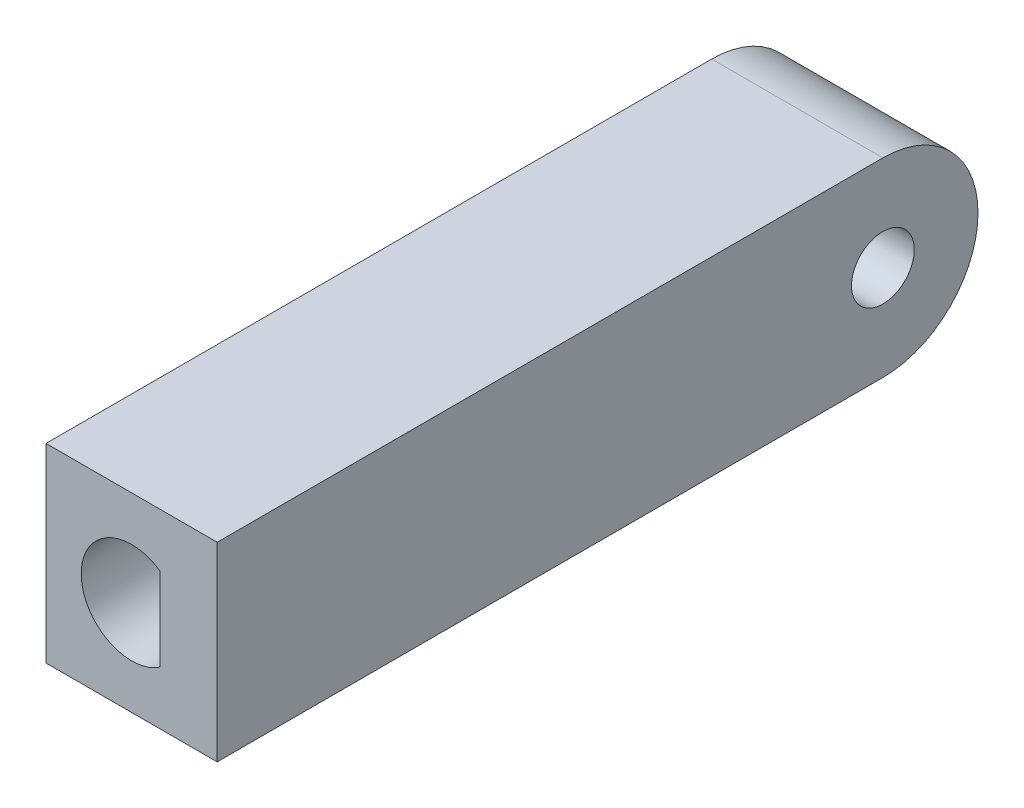
from build123d import *

# Parameters (mm, degrees)
SKIZZE1_W                       = 9
SKIZZE1_H                       = 10
AUFSATZ_LINEAR_AUSTRAGEN1_DEPTH = 40
SKIZZE3_R                       = 1.65
SCHNITT_LINEAR_AUSTRAGEN2_DEPTH = 43.201895692
VERRUNDUNG1_R                   = 5
SCHNITT_LINEAR_AUSTRAGEN3_DEPTH = 10


with BuildPart() as part:
    # Skizze1 → Aufsatz-Linear austragen1 (new body)
    with BuildSketch(Plane.XY):
        with Locations((4.5, 5)):
            Rectangle(SKIZZE1_W, SKIZZE1_H)
    extrude(amount=AUFSATZ_LINEAR_AUSTRAGEN1_DEPTH)

    # Skizze3 → Schnitt-Linear austragen2 (cut, through all)
    with BuildSketch(Plane.ZY):
        with Locations((5, 5)):
            Circle(SKIZZE3_R)
    extrude(amount=-SCHNITT_LINEAR_AUSTRAGEN2_DEPTH, mode=Mode.SUBTRACT)

    # Verrundung1
    verrundung1_edges = [part.edges().sort_by_distance(p)[0] for p in [
        (4.5, 0, 0),
        (4.5, 10, 0),
    ]]
    fillet(verrundung1_edges, radius=VERRUNDUNG1_R - 0.0001)  # a hair under: the kernel refuses the full size

    # Skizze4 → Schnitt-Linear austragen3 (cut)
    with BuildSketch(Plane.XY.offset(40)):
        with BuildLine():
            Line((6, 2.815394773), (6, 7.184605227))
            ThreePointArc((6, 7.184605227), (1.85, 5), (6, 2.815394773))
        make_face()
    extrude(amount=-SCHNITT_LINEAR_AUSTRAGEN3_DEPTH, mode=Mode.SUBTRACT)


solid = part.part
